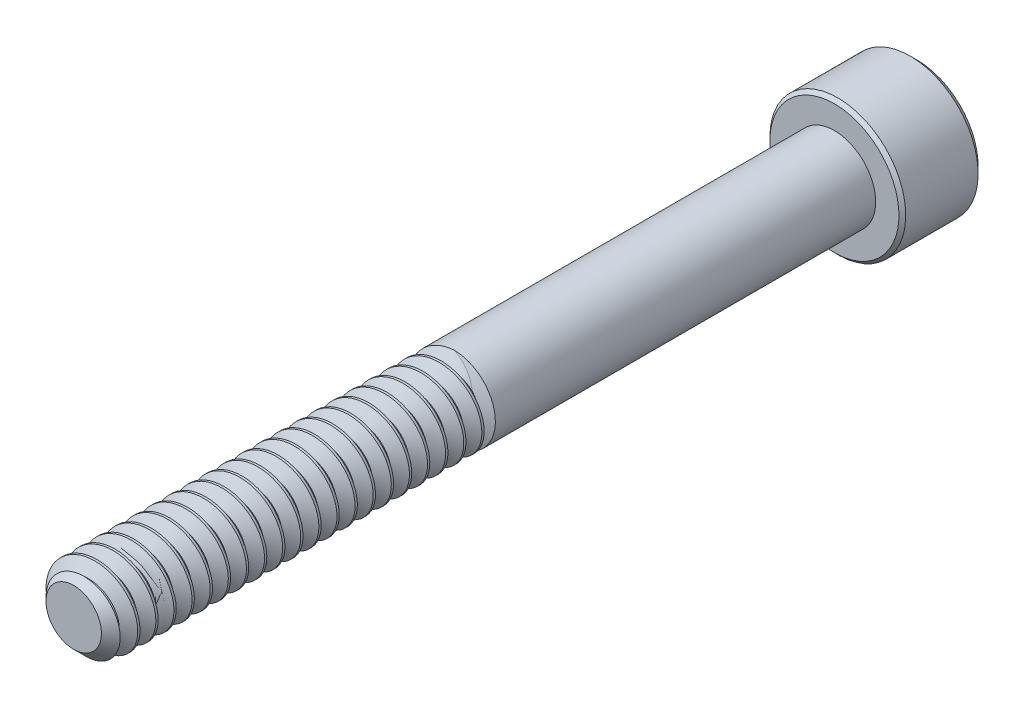
from build123d import *
from build123d.topology import SkipClean

# Parameters (mm, degrees)
SKETCH1_R          = 2.413
EXTRUDE1_DEPTH     = 44.45
CHAMFER3_SIZE      = 0.79375
CUT_SWEEP1_PITCH   = 1.058333333
SKETCH6_R          = 3.96875
EXTRUDE2_DEPTH     = 4.826
CUT_EXTRUDE1_DEPTH = 2.9765625
CHAMFER1_SIZE      = 0.396875
CHAMFER2_SIZE      = 0.1984375


with BuildPart() as part:
    # Sketch1 → Extrude1 (new body)
    with BuildSketch(Plane.XY):
        Circle(SKETCH1_R)
    extrude(amount=-EXTRUDE1_DEPTH)

    # Chamfer3
    chamfer3_edges = [part.edges().sort_by_distance(p)[0] for p in [
        (-2.413, 0, 0),
    ]]
    chamfer(chamfer3_edges, length=CHAMFER3_SIZE)

    # Cut-Sweep1: the profile of Sketch3 profile screwed along a right-hand helix of 43 turns, 6 arcs to a turn; built about Z, then put on its axis
    cut_sweep1_z = Axis((0, 0, 0), (0, 0, 1))
    cut_sweep1_corners = [(2.4133, 0, -0.926214872), (1.725592336, 0, -0.529166667), (1.725592336, 0, -0.396875), (2.4133, 0, 0.000173205)]
    with BuildLine(mode=Mode.PRIVATE) as cut_sweep1_profile:
        Line(cut_sweep1_corners[0], cut_sweep1_corners[1])
        Line(cut_sweep1_corners[1], cut_sweep1_corners[2])
        Line(cut_sweep1_corners[2], cut_sweep1_corners[3])
        Line(cut_sweep1_corners[3], cut_sweep1_corners[0])
    cut_sweep1_cap = Face(cut_sweep1_profile.wire())
    cut_sweep1_turn_angles = [0, 30, 60, 90, 120, 150, 180, 210, 240, 270, 300, 330, 360, 390, 420, 450, 480, 510, 540, 570, 600, 630, 660, 690, 720]
    cut_sweep1_turn_weights = [1, 0.8660254037844387, 1, 0.8660254037844387, 1, 0.8660254037844387, 1, 0.8660254037844387, 1, 0.8660254037844387, 1, 0.8660254037844387, 1, 0.8660254037844387, 1, 0.8660254037844387, 1, 0.8660254037844387, 1, 0.8660254037844387, 1, 0.8660254037844387, 1, 0.8660254037844387, 1]
    cut_sweep1_turn_rails = [Edge.make_bspline([Vector(p[0], p[1], 0).rotate(cut_sweep1_z, cut_sweep1_turn_angles[k]) / cut_sweep1_turn_weights[k] + Vector(0, 0, p[2] + CUT_SWEEP1_PITCH * cut_sweep1_turn_angles[k] / 360) for k in range(25)], [0, 0, 0, 1, 1, 2, 2, 3, 3, 4, 4, 5, 5, 6, 6, 7, 7, 8, 8, 9, 9, 10, 10, 11, 11, 12, 12, 12], 2, cut_sweep1_turn_weights) for p in cut_sweep1_corners]
    cut_sweep1_turn_sides = [Face.make_surface_from_curves(cut_sweep1_turn_rails[p[0]], cut_sweep1_turn_rails[p[1]]) for p in [(0, 1), (1, 2), (2, 3), (3, 0)]]
    cut_sweep1_last_angles = [15120, 15150, 15180, 15210, 15240, 15270, 15300, 15330, 15360, 15390, 15420, 15450, 15480]
    cut_sweep1_last_weights = [1, 0.8660254037844387, 1, 0.8660254037844387, 1, 0.8660254037844387, 1, 0.8660254037844387, 1, 0.8660254037844387, 1, 0.8660254037850578, 1]
    cut_sweep1_last_rails = [Edge.make_bspline([Vector(p[0], p[1], 0).rotate(cut_sweep1_z, cut_sweep1_last_angles[k]) / cut_sweep1_last_weights[k] + Vector(0, 0, p[2] + CUT_SWEEP1_PITCH * cut_sweep1_last_angles[k] / 360) for k in range(13)], [0, 0, 0, 1, 1, 2, 2, 3, 3, 4, 4, 5, 5, 6, 6, 6], 2, cut_sweep1_last_weights) for p in cut_sweep1_corners]
    cut_sweep1_last_sides = [Face.make_surface_from_curves(cut_sweep1_last_rails[p[0]], cut_sweep1_last_rails[p[1]]) for p in [(0, 1), (1, 2), (2, 3), (3, 0)]]
    cut_sweep1 = Plane(origin=(0, 0, 0), x_dir=(0, 1, 0), z_dir=(0, 0, -1)) * Solid(Shell([*[p.moved(Location((0, 0, 2 * CUT_SWEEP1_PITCH * i))) for i in range(21) for p in cut_sweep1_turn_sides], *cut_sweep1_last_sides, cut_sweep1_cap, cut_sweep1_cap.rotate(cut_sweep1_z, 15480).moved(Location((0, 0, CUT_SWEEP1_PITCH * 15480 / 360)))]))
    add(cut_sweep1, mode=Mode.SUBTRACT)

    # Sketch5 → partially thread (revolve)
    with SkipClean():  # the faces are left unmerged after this step: merging them gives an invalid solid
        with BuildSketch(Plane(origin=(0, 0, 0), x_dir=(0, 0, -1), z_dir=(1, 0, 0)), mode=Mode.PRIVATE) as partially_thread_sk:
            Polygon((44.45, 2.413), (22.225, 2.413), (21.346739825, 0), (44.45, 0), align=None)
        revolve(partially_thread_sk.sketch.rotate(Axis((0, 0, 0), (0, 0, -1)), 90), axis=Axis((0, 0, 0), (0, 0, -1)))

    # Sketch6 → Extrude2 (add)
    with BuildSketch(Plane(origin=(0, 0, -44.45), x_dir=(-1, 0, 0), z_dir=(0, 0, -1))):
        Circle(SKETCH6_R)
    extrude(amount=EXTRUDE2_DEPTH)

    # Sketch7 → Cut-Extrude1 (cut)
    with BuildSketch(Plane(origin=(0, 0, -49.276), x_dir=(-1, 0, 0), z_dir=(0, 0, -1))):
        Polygon((0, 2.291358881), (-1.984375, 1.14567944), (-1.984375, -1.14567944), (0, -2.291358881), (1.984375, -1.14567944), (1.984375, 1.14567944), align=None)
    extrude(amount=-CUT_EXTRUDE1_DEPTH, mode=Mode.SUBTRACT)

    # Cut-Extrude2 cone 1 section (through the dimple's axis) → Cut-Extrude2 (revolve, cut)
    with BuildSketch(Plane(origin=(0, 0, -49.276), x_dir=(0, 1, 0), z_dir=(1, 0, 0))):
        Polygon((0, 0), (2.291358881, 0), (0, 2.291358881), align=None)
    revolve(axis=Axis((0, 0, -49.276), (0, 0, 1)), mode=Mode.SUBTRACT)

    # Chamfer1
    chamfer1_edges = [part.edges().sort_by_distance(p)[0] for p in [
        (3.96875, 0, -49.276),
    ]]
    chamfer(chamfer1_edges, length=CHAMFER1_SIZE)

    # Chamfer2
    chamfer2_edges = [part.edges().sort_by_distance(p)[0] for p in [
        (3.96875, 0, -44.45),
    ]]
    chamfer(chamfer2_edges, length=CHAMFER2_SIZE)


solid = part.part
